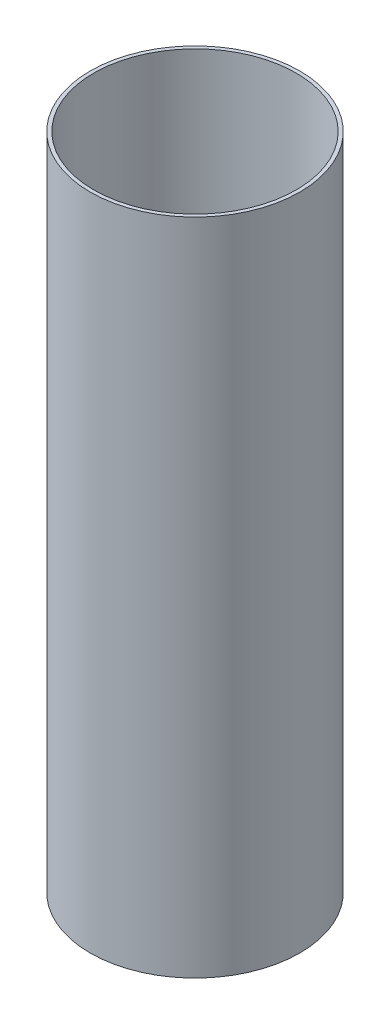
from build123d import *

# Parameters (mm, degrees)
SKETCH1_R           = 17.5
SKETCH1_R_2         = 16.9
BOSS_EXTRUDE1_DEPTH = 55


with BuildPart() as part:
    # Sketch1 → Boss-Extrude1 (new, symmetric)
    with BuildSketch(Plane(origin=(0, 0, 0), x_dir=(1, 0, 0), z_dir=(0, 1, 0))):
        Circle(SKETCH1_R)
        Circle(SKETCH1_R_2, mode=Mode.SUBTRACT)
    extrude(amount=BOSS_EXTRUDE1_DEPTH, both=True)


solid = part.part
